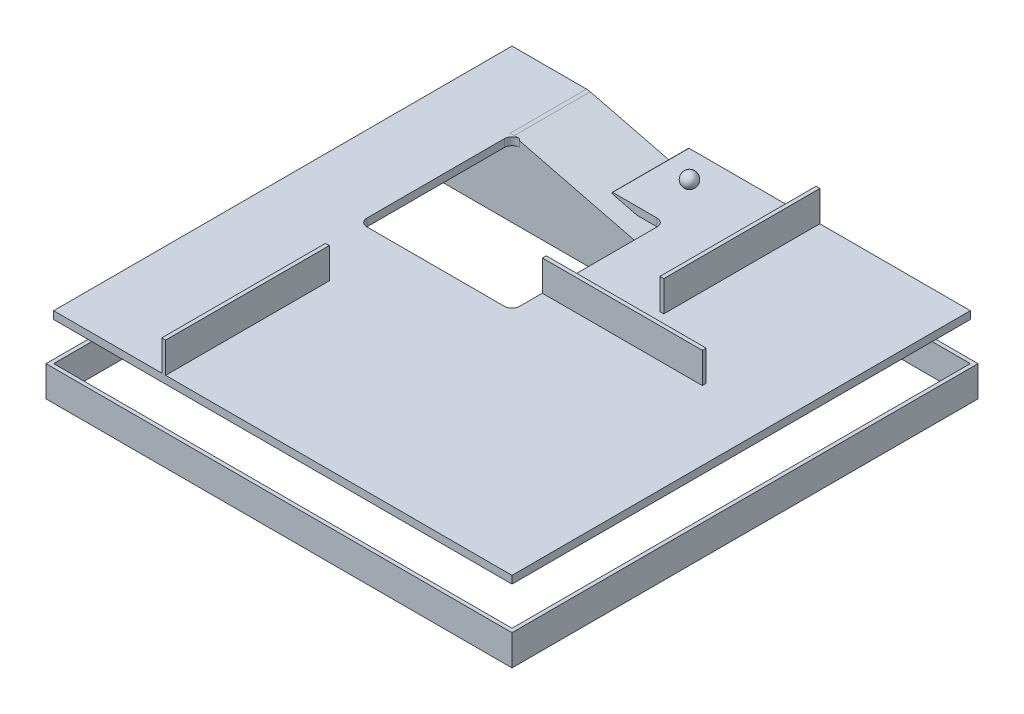
from build123d import *
from build123d.topology import SkipClean

# Parameters (mm, degrees)
SKETCH_1_W          = 6100
SKETCH_1_H          = 6100
SKETCH_1_W_2        = 6000
SKETCH_1_H_2        = 6000
EXTRUDE_1_DEPTH     = 400
EXTRUDE_2_DEPTH     = 1000
SKETCH_6_W          = 6000
SKETCH_6_H          = 6000
EXTRUDE_3_DEPTH     = 100
CUT_EXTRUDE_1_DEPTH = 300
FILLET_1_R          = 10
FILLET_2_R          = 200
SKETCH_10_W         = 50
SKETCH_10_H         = 2142.742214085
SKETCH_10_W_2       = 2091.819969514
SKETCH_10_H_2       = 50
SKETCH_10_H_3       = 2042.86752058
EXTRUDE_4_DEPTH     = 400


with BuildPart() as part:
    # 草图1 → 凸台-拉伸1 (new body)
    with BuildSketch(Plane(origin=(0, 0, 0), x_dir=(1, 0, 0), z_dir=(0, 1, 0))):
        with Locations((3000, 3000)):
            Rectangle(SKETCH_1_W, SKETCH_1_H)
        with Locations((3000, 3000)):
            Rectangle(SKETCH_1_W_2, SKETCH_1_H_2, mode=Mode.SUBTRACT)
    extrude(amount=EXTRUDE_1_DEPTH)

    # 草图5 → 凸台-拉伸2 (add)
    with BuildSketch(Plane.XY.offset(-6000)):
        Polygon((5000, 0), (1000, 1000), (0, 1000), (0, 0), align=None)
    extrude(amount=EXTRUDE_2_DEPTH)

    # 草图6 → 凸台-拉伸3 (add)
    with BuildSketch(Plane(origin=(0, 1000, 0), x_dir=(1, 0, 0), z_dir=(0, 1, 0))):
        with Locations((3000, 3000)):
            Rectangle(SKETCH_6_W, SKETCH_6_H)
        with BuildLine():
            Line((1100, 5000), (2900, 5000))
            ThreePointArc((2900, 5000), (2970.710678119, 4970.710678119), (3000, 4900))
            Line((3000, 4900), (3000, 3100))
            ThreePointArc((3000, 3100), (2970.710678119, 3029.289321881), (2900, 3000))
            Line((2900, 3000), (1100, 3000))
            ThreePointArc((1100, 3000), (1029.289321881, 3029.289321881), (1000, 3100))
            Line((1000, 3100), (1000, 4900))
            ThreePointArc((1000, 4900), (1029.289321881, 4970.710678119), (1100, 5000))
        make_face(mode=Mode.SUBTRACT)
    extrude(amount=-EXTRUDE_3_DEPTH)

    # 草图9 → 切除-拉伸1 (cut)
    with BuildSketch(Plane(origin=(294.117647059, 1176.470588235, 0), x_dir=(0.9701425001453319, -0.24253562503633308, 0), z_dir=(0.24253562503633308, 0.9701425001453319, 0))):
        Polygon((-97.014250015, 5000), (-97.014250015, 6000), (3201.47025048, 6000), (4850.712500727, 6000), (4850.712500727, 5000), align=None)
    extrude(amount=CUT_EXTRUDE_1_DEPTH, mode=Mode.SUBTRACT)

    # 圆角1
    fillet_1_edges = [part.edges().sort_by_distance(p)[0] for p in [
        (2236.931687685, 1000, -5500),
    ]]
    fillet(fillet_1_edges, radius=FILLET_1_R)

    # 圆角2
    fillet_2_edges = [part.edges().sort_by_distance(p)[0] for p in [
        (1000, 1000, -5500),
    ]]
    fillet(fillet_2_edges, radius=FILLET_2_R)

    # 草图10 → 凸台-拉伸4 (add)
    with BuildSketch(Plane(origin=(0, 1000, 0), x_dir=(1, 0, 0), z_dir=(0, 1, 0))):
        with Locations((1440.876389135, 1071.371107043)):
            Rectangle(SKETCH_10_W, SKETCH_10_H)
        with Locations((4048.684281799, 3421.724476977)):
            Rectangle(SKETCH_10_W_2, SKETCH_10_H_2)
        with Locations((4004.326855754, 4978.56623971)):
            Rectangle(SKETCH_10_W, SKETCH_10_H_3)
    extrude(amount=EXTRUDE_4_DEPTH)


with BuildPart() as body_2:
    # 草图12 → 旋转2 (revolve)
    with SkipClean():  # the faces are left unmerged after this step: merging them gives an invalid solid
        with BuildSketch(Plane(origin=(0, 1095, 0), x_dir=(1, 0, 0), z_dir=(0, 1, 0)), mode=Mode.PRIVATE) as revolve_2_sk:
            with BuildLine():
                ThreePointArc((2768.869220223, 5649.445371303), (2673.869220223, 5554.445371303), (2768.869220223, 5459.445371303))
                Line((2768.869220223, 5459.445371303), (2768.869220223, 5649.445371303))
            make_face()
            with BuildLine():
                Line((2768.869220223, 5649.445371303), (2768.869220223, 5459.445371303))
                ThreePointArc((2768.869220223, 5459.445371303), (2836.044364436, 5487.270227091), (2863.869220223, 5554.445371303))
                ThreePointArc((2863.869220223, 5554.445371303), (2836.044364436, 5621.620515516), (2768.869220223, 5649.445371303))
            make_face()
        revolve(revolve_2_sk.sketch.rotate(Axis((2768.869220223, 1095, -4554.445371303), (0, 0, -1)), 180), axis=Axis((2768.869220223, 1095, -4554.445371303), (0, 0, -1)))
    add(body_2.part.scale(1), mode=Mode.REPLACE)  # the faces are merged on a copy


solid = Compound([part.part, body_2.part])
